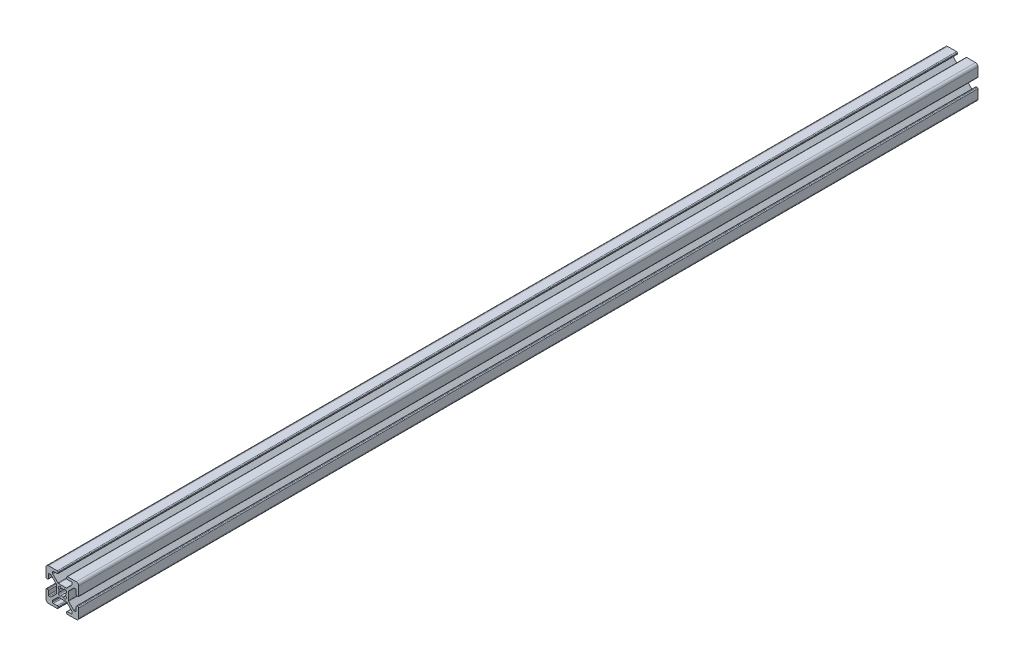
from build123d import *

# Parameters (mm, degrees)
EXTRUDE1_DEPTH = 550


with BuildPart() as part:
    # Sketch1 → Extrude1 (new body)
    with BuildSketch(Plane.XY):
        with BuildLine():
            Line((-5.032287798, -0.341059771), (-5.516287798, -0.341059771))
            ThreePointArc((-5.516287798, -0.341059771), (-5.875498042, -0.192270016), (-6.024287798, 0.166940229))
            Line((-6.024287798, 0.166940229), (-6.024287798, 2.515940229))
            ThreePointArc((-6.024287798, 2.515940229), (-6.173077553, 2.875150474), (-6.532287798, 3.023940229))
            Line((-6.532287798, 3.023940229), (-7.258207136, 3.023940229))
            ThreePointArc((-7.258207136, 3.023940229), (-7.45261032, 2.985271032), (-7.617417381, 2.875150474))
            Line((-7.617417381, 2.875150474), (-10.720498042, -0.227930187))
            ThreePointArc((-10.720498042, -0.227930187), (-10.8306186, -0.392737249), (-10.869287798, -0.587140432))
            Line((-10.869287798, -0.587140432), (-10.869287798, -5.354979109))
            ThreePointArc((-10.869287798, -5.354979109), (-10.8306186, -5.549382293), (-10.720498042, -5.714189354))
            Line((-10.720498042, -5.714189354), (-7.617417381, -8.817270016))
            ThreePointArc((-7.617417381, -8.817270016), (-7.45261032, -8.927390573), (-7.258207136, -8.966059771))
            Line((-7.258207136, -8.966059771), (-6.532287798, -8.966059771))
            ThreePointArc((-6.532287798, -8.966059771), (-6.173077553, -8.817270016), (-6.024287798, -8.458059771))
            Line((-6.024287798, -8.458059771), (-6.024287798, -6.109059771))
            ThreePointArc((-6.024287798, -6.109059771), (-5.875498042, -5.749849526), (-5.516287798, -5.601059771))
            Line((-5.516287798, -5.601059771), (-5.032287798, -5.601059771))
            ThreePointArc((-5.032287798, -5.601059771), (-4.673077553, -5.749849526), (-4.524287798, -6.109059771))
            Line((-4.524287798, -6.109059771), (-4.524287798, -11.471059771))
            ThreePointArc((-4.524287798, -11.471059771), (-4.963627626, -12.531719943), (-6.024287798, -12.971059771))
            Line((-6.024287798, -12.971059771), (-11.386287798, -12.971059771))
            ThreePointArc((-11.386287798, -12.971059771), (-11.745498042, -12.822270016), (-11.894287798, -12.463059771))
            Line((-11.894287798, -12.463059771), (-11.894287798, -11.979059771))
            ThreePointArc((-11.894287798, -11.979059771), (-11.745498042, -11.619849526), (-11.386287798, -11.471059771))
            Line((-11.386287798, -11.471059771), (-9.037287798, -11.471059771))
            ThreePointArc((-9.037287798, -11.471059771), (-8.678077553, -11.322270016), (-8.529287798, -10.963059771))
            Line((-8.529287798, -10.963059771), (-8.529287798, -10.237140432))
            ThreePointArc((-8.529287798, -10.237140432), (-8.567956995, -10.042737249), (-8.678077553, -9.877930187))
            Line((-8.678077553, -9.877930187), (-11.781158214, -6.774849526))
            ThreePointArc((-11.781158214, -6.774849526), (-11.945965275, -6.664728968), (-12.140368459, -6.626059771))
            Line((-12.140368459, -6.626059771), (-16.908207136, -6.626059771))
            ThreePointArc((-16.908207136, -6.626059771), (-17.10261032, -6.664728968), (-17.267417381, -6.774849526))
            Line((-17.267417381, -6.774849526), (-20.370498042, -9.877930187))
            ThreePointArc((-20.370498042, -9.877930187), (-20.4806186, -10.042737249), (-20.519287798, -10.237140432))
            Line((-20.519287798, -10.237140432), (-20.519287798, -10.963059771))
            ThreePointArc((-20.519287798, -10.963059771), (-20.370498042, -11.322270016), (-20.011287798, -11.471059771))
            Line((-20.011287798, -11.471059771), (-17.662287798, -11.471059771))
            ThreePointArc((-17.662287798, -11.471059771), (-17.303077553, -11.619849526), (-17.154287798, -11.979059771))
            Line((-17.154287798, -11.979059771), (-17.154287798, -12.463059771))
            ThreePointArc((-17.154287798, -12.463059771), (-17.303077553, -12.822270016), (-17.662287798, -12.971059771))
            Line((-17.662287798, -12.971059771), (-23.024287798, -12.971059771))
            ThreePointArc((-23.024287798, -12.971059771), (-24.084947969, -12.531719943), (-24.524287798, -11.471059771))
            Line((-24.524287798, -11.471059771), (-24.524287798, -6.109059771))
            ThreePointArc((-24.524287798, -6.109059771), (-24.375498042, -5.749849526), (-24.016287798, -5.601059771))
            Line((-24.016287798, -5.601059771), (-23.532287798, -5.601059771))
            ThreePointArc((-23.532287798, -5.601059771), (-23.173077553, -5.749849526), (-23.024287798, -6.109059771))
            Line((-23.024287798, -6.109059771), (-23.024287798, -8.458059771))
            ThreePointArc((-23.024287798, -8.458059771), (-22.875498042, -8.817270016), (-22.516287798, -8.966059771))
            Line((-22.516287798, -8.966059771), (-21.790368459, -8.966059771))
            ThreePointArc((-21.790368459, -8.966059771), (-21.595965275, -8.927390573), (-21.431158214, -8.817270016))
            Line((-21.431158214, -8.817270016), (-18.328077553, -5.714189354))
            ThreePointArc((-18.328077553, -5.714189354), (-18.217956995, -5.549382293), (-18.179287798, -5.354979109))
            Line((-18.179287798, -5.354979109), (-18.179287798, -0.587140432))
            ThreePointArc((-18.179287798, -0.587140432), (-18.217956995, -0.392737249), (-18.328077553, -0.227930187))
            Line((-18.328077553, -0.227930187), (-21.431158214, 2.875150474))
            ThreePointArc((-21.431158214, 2.875150474), (-21.595965275, 2.985271032), (-21.790368459, 3.023940229))
            Line((-21.790368459, 3.023940229), (-22.516287798, 3.023940229))
            ThreePointArc((-22.516287798, 3.023940229), (-22.875498042, 2.875150474), (-23.024287798, 2.515940229))
            Line((-23.024287798, 2.515940229), (-23.024287798, 0.166940229))
            ThreePointArc((-23.024287798, 0.166940229), (-23.173077553, -0.192270016), (-23.532287798, -0.341059771))
            Line((-23.532287798, -0.341059771), (-24.016287798, -0.341059771))
            ThreePointArc((-24.016287798, -0.341059771), (-24.375498042, -0.192270016), (-24.524287798, 0.166940229))
            Line((-24.524287798, 0.166940229), (-24.524287798, 5.528940229))
            ThreePointArc((-24.524287798, 5.528940229), (-24.084947969, 6.589600401), (-23.024287798, 7.028940229))
            Line((-23.024287798, 7.028940229), (-17.662287798, 7.028940229))
            ThreePointArc((-17.662287798, 7.028940229), (-17.303077553, 6.880150474), (-17.154287798, 6.520940229))
            Line((-17.154287798, 6.520940229), (-17.154287798, 6.036940229))
            ThreePointArc((-17.154287798, 6.036940229), (-17.303077553, 5.677729984), (-17.662287798, 5.528940229))
            Line((-17.662287798, 5.528940229), (-20.011287798, 5.528940229))
            ThreePointArc((-20.011287798, 5.528940229), (-20.370498042, 5.380150474), (-20.519287798, 5.020940229))
            Line((-20.519287798, 5.020940229), (-20.519287798, 4.295020891))
            ThreePointArc((-20.519287798, 4.295020891), (-20.4806186, 4.100617707), (-20.370498042, 3.935810646))
            Line((-20.370498042, 3.935810646), (-17.267417381, 0.832729984))
            ThreePointArc((-17.267417381, 0.832729984), (-17.10261032, 0.722609427), (-16.908207136, 0.683940229))
            Line((-16.908207136, 0.683940229), (-12.140368459, 0.683940229))
            ThreePointArc((-12.140368459, 0.683940229), (-11.945965275, 0.722609427), (-11.781158214, 0.832729984))
            Line((-11.781158214, 0.832729984), (-8.678077553, 3.935810646))
            ThreePointArc((-8.678077553, 3.935810646), (-8.567956995, 4.100617707), (-8.529287798, 4.295020891))
            Line((-8.529287798, 4.295020891), (-8.529287798, 5.020940229))
            ThreePointArc((-8.529287798, 5.020940229), (-8.678077553, 5.380150474), (-9.037287798, 5.528940229))
            Line((-9.037287798, 5.528940229), (-11.386287798, 5.528940229))
            ThreePointArc((-11.386287798, 5.528940229), (-11.745498042, 5.677729984), (-11.894287798, 6.036940229))
            Line((-11.894287798, 6.036940229), (-11.894287798, 6.520940229))
            ThreePointArc((-11.894287798, 6.520940229), (-11.745498042, 6.880150474), (-11.386287798, 7.028940229))
            Line((-11.386287798, 7.028940229), (-6.024287798, 7.028940229))
            ThreePointArc((-6.024287798, 7.028940229), (-4.963627626, 6.589600401), (-4.524287798, 5.528940229))
            Line((-4.524287798, 5.528940229), (-4.524287798, 0.166940229))
            ThreePointArc((-4.524287798, 0.166940229), (-4.673077553, -0.192270016), (-5.032287798, -0.341059771))
        make_face()
        with BuildLine():
            Line((-12.399386954, -5.275565737), (-12.219781831, -5.095960615))
            ThreePointArc((-12.219781831, -5.095960615), (-12.018349781, -4.327527582), (-12.589154291, -3.775036489))
            ThreePointArc((-12.589154291, -3.775036489), (-12.428787798, -2.971059771), (-12.589154291, -2.167083053))
            ThreePointArc((-12.589154291, -2.167083053), (-12.018349781, -1.61459196), (-12.219781831, -0.846158927))
            Line((-12.219781831, -0.846158927), (-12.399386954, -0.666553805))
            ThreePointArc((-12.399386954, -0.666553805), (-13.167819987, -0.465121754), (-13.72031108, -1.035926265))
            ThreePointArc((-13.72031108, -1.035926265), (-14.524287798, -0.875559771), (-15.328264516, -1.035926265))
            ThreePointArc((-15.328264516, -1.035926265), (-15.880755608, -0.465121754), (-16.649188641, -0.666553805))
            Line((-16.649188641, -0.666553805), (-16.828793764, -0.846158927))
            ThreePointArc((-16.828793764, -0.846158927), (-17.030225814, -1.61459196), (-16.459421304, -2.167083053))
            ThreePointArc((-16.459421304, -2.167083053), (-16.619787798, -2.971059771), (-16.459421304, -3.775036489))
            ThreePointArc((-16.459421304, -3.775036489), (-17.030225814, -4.327527582), (-16.828793764, -5.095960615))
            Line((-16.828793764, -5.095960615), (-16.649188641, -5.275565737))
            ThreePointArc((-16.649188641, -5.275565737), (-15.880755608, -5.476997788), (-15.328264516, -4.906193277))
            ThreePointArc((-15.328264516, -4.906193277), (-14.524287798, -5.066559771), (-13.72031108, -4.906193277))
            ThreePointArc((-13.72031108, -4.906193277), (-13.167819987, -5.476997788), (-12.399386954, -5.275565737))
        make_face(mode=Mode.SUBTRACT)
    extrude(amount=EXTRUDE1_DEPTH)


solid = part.part
